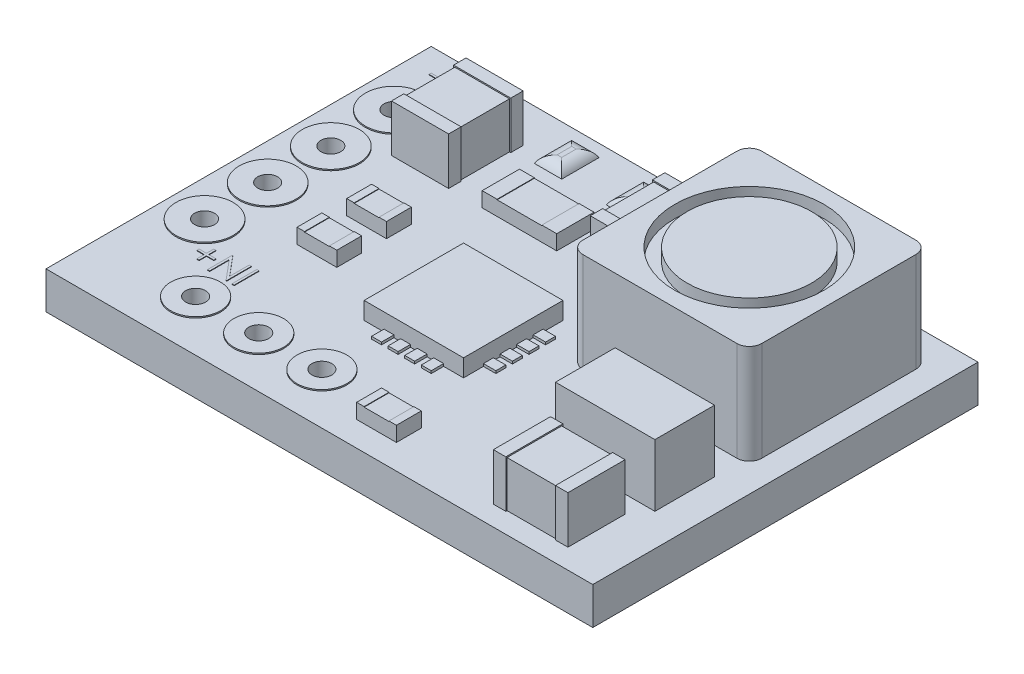
from build123d import *

# Parameters (mm, degrees)
SKICA1_W                             = 22
SKICA1_H                             = 15.5
P_IDAT_VYSUNUT_M1_DEPTH              = 1.5
SKICA2_W                             = 7.2
SKICA2_H                             = 7.2
P_IDAT_VYSUNUT_M2_DEPTH              = 4
ZAOBLIT1_R                           = 0.5
SKICA3_R                             = 3
SKICA3_R_2                           = 2.5
ODEBRAT_VYSUNUT_M1_DEPTH             = 0.5
SKICA4_W                             = 4
SKICA4_H                             = 2.4
P_IDAT_VYSUNUT_M3_DEPTH              = 2.5
SKICA5_W                             = 0.5
SKICA5_H                             = 2.3
SKICA5_W_2                           = 2.3
SKICA5_H_2                           = 0.5
P_IDAT_VYSUNUT_M4_DEPTH              = 1.9
SKICA6_W                             = 2
SKICA6_H                             = 2.2
SKICA6_W_2                           = 2.2
SKICA6_H_2                           = 2
P_IDAT_VYSUNUT_M5_DEPTH              = 1.85
SKICA7_W                             = 4
SKICA7_H                             = 4
P_IDAT_VYSUNUT_M6_DEPTH              = 0.7
SKICA8_W                             = 0.4
SKICA8_H                             = 0.5
P_IDAT_VYSUNUT_M7_DEPTH              = 0.1
SKICA9_R                             = 0.05
ODEBRAT_VYSUNUT_M2_DEPTH             = 0.2
KRUHOV_POLE1_COUNT                   = 4
SKICA11_W                            = 1.1
SKICA11_H                            = 1.5
P_IDAT_VYSUNUT_M8_DEPTH              = 0.3
ZAOBLIT2_R                           = 0.5
SKICA12_W                            = 0.6
SKICA12_H                            = 1.5
P_IDAT_VYSUNUT_M9_DEPTH              = 0.6
SKICA13_W                            = 1.8
SKICA13_H                            = 1.5
P_IDAT_VYSUNUT_M10_DEPTH             = 0.58
SKICA14_R                            = 0.4
ODEBRAT_VYSUNUT_M3_DEPTH             = 28.207535721
P_IDAT_VYSUNUT_M11_DEPTH             = 0.05
P_IDAT_VYSUNUT_M11_DEPTH_BACK        = 1.55
SKICA15_R                            = 1
SKICA15_R_2                          = 0.4
SKICA17_R                            = 0.4
ODEBRAT_VYSUNUT_M4_DEPTH             = 28.207535721
P_IDAT_VYSUNUT_M13_REACH             = 29.208
SKICA18_R                            = 1.15
SKICA18_R_2                          = 0.4
P_IDAT_VYSUNUT_M13_DIRECTION_2_REACH = 29.208
LINPOLE1_COUNT                       = 4
LINPOLE1_PITCH                       = 2.54
SKICA20_W                            = 0.3
SKICA20_H                            = 1
P_IDAT_VYSUNUT_M14_DEPTH             = 0.6
SKICA22_W                            = 1
SKICA22_H                            = 1
P_IDAT_VYSUNUT_M15_DEPTH             = 0.58
LINPOLE2_COUNT                       = 2
LINPOLE2_PITCH                       = 2
SKICA24_W                            = 0.3
SKICA24_H                            = 1
P_IDAT_VYSUNUT_M16_DEPTH             = 0.6
SKICA26_W                            = 1
SKICA26_H                            = 1
P_IDAT_VYSUNUT_M17_DEPTH             = 0.58
SKICA27_W                            = 0.08974359
SKICA27_H                            = 1
P_IDAT_VYSUNUT_M18_DEPTH             = 0.02
SKICA28_W                            = 17
SKICA28_H                            = 10
P_IDAT_VYSUNUT_M19_DEPTH             = 0.05


with BuildPart() as part:
    # Skica1 → Přidat vysunutím1 (new body)
    with BuildSketch(Plane(origin=(0, 0, 0), x_dir=(1, 0, 0), z_dir=(0, 1, 0))):
        with Locations((11, 7.75)):
            Rectangle(SKICA1_W, SKICA1_H)
    extrude(amount=P_IDAT_VYSUNUT_M1_DEPTH)

    # Skica2 → Přidat vysunutím2 (add)
    with BuildSketch(Plane(origin=(0, 1.5, 0), x_dir=(1, 0, 0), z_dir=(0, 1, 0))):
        with Locations((17.4, 10.9)):
            Rectangle(SKICA2_W, SKICA2_H)
    extrude(amount=P_IDAT_VYSUNUT_M2_DEPTH)

    # Zaoblit1
    zaoblit1_edges = [part.edges().sort_by_distance(p)[0] for p in [
        (21, 3.5, -7.3),
        (21, 3.5, -14.5),
        (13.8, 3.5, -14.5),
        (13.8, 3.5, -7.3),
    ]]
    fillet(zaoblit1_edges, radius=ZAOBLIT1_R)

    # Skica3 → Odebrat vysunutím1 (cut)
    with BuildSketch(Plane(origin=(0, 5.5, 0), x_dir=(1, 0, 0), z_dir=(0, 1, 0))):
        with Locations(Location((17.4, 10.9, 0), (0, 0, 270))):
            Circle(SKICA3_R)
        with Locations(Location((17.4, 10.9, 0), (0, 0, 270))):
            Circle(SKICA3_R_2, mode=Mode.SUBTRACT)
    extrude(amount=-ODEBRAT_VYSUNUT_M1_DEPTH, mode=Mode.SUBTRACT)

    # Skica4 → Přidat vysunutím3 (add)
    with BuildSketch(Plane(origin=(0, 1.5, 0), x_dir=(1, 0, 0), z_dir=(0, 1, 0))):
        with Locations((18.7, 5)):
            Rectangle(SKICA4_W, SKICA4_H)
    extrude(amount=P_IDAT_VYSUNUT_M3_DEPTH)

    # Skica5 → Přidat vysunutím4 (add)
    with BuildSketch(Plane(origin=(0, 1.5, 0), x_dir=(1, 0, 0), z_dir=(0, 1, 0))):
        with Locations((19.95, 1.95)):
            Rectangle(SKICA5_W, SKICA5_H)
        with Locations((17.45, 1.95)):
            Rectangle(SKICA5_W, SKICA5_H)
        with Locations((4.15, 13.65)):
            Rectangle(SKICA5_W_2, SKICA5_H_2)
        with Locations((4.15, 11.15)):
            Rectangle(SKICA5_W_2, SKICA5_H_2)
        with Locations((12.15, 13.65)):
            Rectangle(SKICA5_W_2, SKICA5_H_2)
        with Locations((12.15, 11.15)):
            Rectangle(SKICA5_W_2, SKICA5_H_2)
    extrude(amount=P_IDAT_VYSUNUT_M4_DEPTH)

    # Skica6 → Přidat vysunutím5 (add)
    with BuildSketch(Plane(origin=(0, 1.5, 0), x_dir=(1, 0, 0), z_dir=(0, 1, 0))):
        with Locations((18.7, 1.95)):
            Rectangle(SKICA6_W, SKICA6_H)
        with Locations((4.15, 12.4)):
            Rectangle(SKICA6_W_2, SKICA6_H_2)
        with Locations((12.15, 12.4)):
            Rectangle(SKICA6_W_2, SKICA6_H_2)
    extrude(amount=P_IDAT_VYSUNUT_M5_DEPTH)

    # Skica7 → Přidat vysunutím6 (add)
    with BuildSketch(Plane(origin=(0, 1.5, 0), x_dir=(1, 0, 0), z_dir=(0, 1, 0))):
        with Locations((10.2, 6.6)):
            Rectangle(SKICA7_W, SKICA7_H)
    extrude(amount=P_IDAT_VYSUNUT_M6_DEPTH)

    # Skica8 → Přidat vysunutím7 (add)
    with BuildSketch(Plane(origin=(0, 1.5, 0), x_dir=(1, 0, 0), z_dir=(0, 1, 0))):
        with Locations((9.866666667, 8.85)):
            Rectangle(SKICA8_W, SKICA8_H)
        with Locations((9.2, 8.85)):
            Rectangle(SKICA8_W, SKICA8_H)
        with Locations((10.533333333, 8.85)):
            Rectangle(SKICA8_W, SKICA8_H)
        with Locations((11.2, 8.85)):
            Rectangle(SKICA8_W, SKICA8_H)
    p_idat_vysunut_m7 = extrude(amount=P_IDAT_VYSUNUT_M7_DEPTH)

    # Skica9 → Odebrat vysunutím2 (cut)
    with BuildSketch(Plane(origin=(0, 1.5, 0), x_dir=(1, 0, 0), z_dir=(0, 1, 0))):
        with Locations(Location((10.2, 6.6, 0), (0, 0, 270))):
            Circle(SKICA9_R)
    extrude(amount=ODEBRAT_VYSUNUT_M2_DEPTH, mode=Mode.SUBTRACT)

    # Kruhové pole1: Přidat vysunutím7 ×4 about axis
    kruhov_pole1_axis = Axis((10.2, 0, -6.6), (0, 1, 0))
    for i in range(1, KRUHOV_POLE1_COUNT):
        add(p_idat_vysunut_m7.rotate(kruhov_pole1_axis, i * 360 / KRUHOV_POLE1_COUNT))

    # Skica11 → Přidat vysunutím8 (add)
    with BuildSketch(Plane(origin=(0, 1.5, 0), x_dir=(1, 0, 0), z_dir=(0, 1, 0))):
        with Locations((6.7, 14.25)):
            Rectangle(SKICA11_W, SKICA11_H)
        with Locations((9.6, 14.25)):
            Rectangle(SKICA11_W, SKICA11_H)
    extrude(amount=P_IDAT_VYSUNUT_M8_DEPTH)

    # Zaoblit2
    # the kernel refuses this fillet: 0.5 mm, written as the material it takes off along each edge
    with BuildSketch(Plane(origin=(7.904356076, 1.8, -15), x_dir=(0, -1, 0), z_dir=(1, 0, 0)), Plane(origin=(5.004356076, 1.8, -15), x_dir=(0, -1, 0), z_dir=(1, 0, 0))) as zaoblit2_piece_1:
        with BuildLine():
            CenterArc((0.5, -0.458257569), ZAOBLIT2_R, 113.578178478, 66.421821522)
            Line((0, -0.458257569), (0, 0))
            Line((0, 0), (0.3, 0))
        make_face()
    extrude(amount=3.391287847, mode=Mode.SUBTRACT)
    with BuildSketch(Plane(origin=(10.15, 1.8, -16.145643924), x_dir=(0, -1, 0), z_dir=(0, 0, 1)), Plane(origin=(9.05, 1.8, -12.354356076), x_dir=(0, -1, 0), z_dir=(0, 0, -1)), Plane(origin=(7.25, 1.8, -16.145643924), x_dir=(0, -1, 0), z_dir=(0, 0, 1)), Plane(origin=(6.15, 1.8, -12.354356076), x_dir=(0, -1, 0), z_dir=(0, 0, -1))) as zaoblit2_piece_2:
        with BuildLine():
            CenterArc((0.5, -0.458257569), ZAOBLIT2_R, 113.578178478, 66.421821522)
            Line((0, -0.458257569), (0, 0))
            Line((0, 0), (0.3, 0))
        make_face()
    extrude(amount=3.791287847, mode=Mode.SUBTRACT)
    with BuildSketch(Plane(origin=(11.295643924, 1.8, -13.5), x_dir=(0, -1, 0), z_dir=(-1, 0, 0))) as zaoblit2_piece_3_section:
        with BuildLine():
            CenterArc((0.5, -0.458257569), ZAOBLIT2_R, 113.578178478, 66.421821522)
            Line((0, -0.458257569), (0, 0))
            Line((0, 0), (0.3, 0))
        make_face()
    zaoblit2_piece_3 = extrude(amount=3.391287847, mode=Mode.PRIVATE)
    zaoblit2_piece_3 = split(zaoblit2_piece_3, bisect_by=Plane(origin=(11, 1.702438627, -13.659854903), z_dir=(-1, 0, 0)), keep=Keep.TOP, mode=Mode.PRIVATE)
    add(zaoblit2_piece_3, mode=Mode.SUBTRACT)
    with BuildSketch(Plane(origin=(8.395643924, 1.8, -13.5), x_dir=(0, -1, 0), z_dir=(-1, 0, 0))) as zaoblit2_piece_4:
        with BuildLine():
            CenterArc((0.5, -0.458257569), ZAOBLIT2_R, 113.578178478, 66.421821522)
            Line((0, -0.458257569), (0, 0))
            Line((0, 0), (0.3, 0))
        make_face()
    extrude(amount=2.245643924, mode=Mode.SUBTRACT)

    # Skica12 → Přidat vysunutím9 (add)
    with BuildSketch(Plane(origin=(0, 1.5, 0), x_dir=(1, 0, 0), z_dir=(0, 1, 0))):
        with Locations((6.95, 11.65)):
            Rectangle(SKICA12_W, SKICA12_H)
        with Locations((9.35, 11.65)):
            Rectangle(SKICA12_W, SKICA12_H)
    extrude(amount=P_IDAT_VYSUNUT_M9_DEPTH)

    # Skica13 → Přidat vysunutím10 (add)
    with BuildSketch(Plane(origin=(0, 1.5, 0), x_dir=(1, 0, 0), z_dir=(0, 1, 0))):
        with Locations((8.15, 11.65)):
            Rectangle(SKICA13_W, SKICA13_H)
    extrude(amount=P_IDAT_VYSUNUT_M10_DEPTH)

    # Skica14 → Odebrat vysunutím3 (cut, through all)
    with BuildSketch(Plane(origin=(0, 1.5, 0), x_dir=(1, 0, 0), z_dir=(0, 1, 0))):
        with Locations(Location((4.02, 2, 0), (0, 0, 270))):
            Circle(SKICA14_R)
        with Locations(Location((6.56, 2, 0), (0, 0, 270))):
            Circle(SKICA14_R)
        with Locations(Location((9.1, 2, 0), (0, 0, 270))):
            Circle(SKICA14_R)
    extrude(amount=-ODEBRAT_VYSUNUT_M3_DEPTH, mode=Mode.SUBTRACT)

    # Skica15 → Přidat vysunutím11 (add, two sides: drawn at the far end of the back side and taken through both)
    # profile 1 of 3: a face of its own
    with BuildSketch(Plane(origin=(0, 1.5, 0), x_dir=(1, 0, 0), z_dir=(0, 1, 0)).offset(-P_IDAT_VYSUNUT_M11_DEPTH_BACK)):
        with Locations(Location((4.02, 2, 0), (0, 0, 90))):
            Circle(SKICA15_R)
        with Locations(Location((4.02, 2, 0), (0, 0, 270))):
            Circle(SKICA15_R_2, mode=Mode.SUBTRACT)
    # profile 2 of 3: a face of its own
    with BuildSketch(Plane(origin=(0, 1.5, 0), x_dir=(1, 0, 0), z_dir=(0, 1, 0)).offset(-P_IDAT_VYSUNUT_M11_DEPTH_BACK)):
        with Locations(Location((6.56, 2, 0), (0, 0, 90))):
            Circle(SKICA15_R)
        with Locations(Location((6.56, 2, 0), (0, 0, 270))):
            Circle(SKICA15_R_2, mode=Mode.SUBTRACT)
    # profile 3 of 3: a face of its own
    with BuildSketch(Plane(origin=(0, 1.5, 0), x_dir=(1, 0, 0), z_dir=(0, 1, 0)).offset(-P_IDAT_VYSUNUT_M11_DEPTH_BACK)):
        with Locations(Location((9.1, 2, 0), (0, 0, 90))):
            Circle(SKICA15_R)
        with Locations(Location((9.1, 2, 0), (0, 0, 270))):
            Circle(SKICA15_R_2, mode=Mode.SUBTRACT)
    extrude(amount=P_IDAT_VYSUNUT_M11_DEPTH + P_IDAT_VYSUNUT_M11_DEPTH_BACK)

    # Skica17 → Odebrat vysunutím4 (cut, through all)
    with BuildSketch(Plane(origin=(0, 1.5, 0), x_dir=(1, 0, 0), z_dir=(0, 1, 0))):
        with Locations(Location((1.5, 12.5, 0), (0, 0, 270))):
            Circle(SKICA17_R)
    odebrat_vysunut_m4 = extrude(amount=-ODEBRAT_VYSUNUT_M4_DEPTH, mode=Mode.SUBTRACT)

    # Přidat vysunutím13: up to this face of the body (flat: up to its plane)
    p_idat_vysunut_m13_end = Plane(part.part.faces().sort_by_distance((4.02, 1.55, -1.028284271))[0])
    # Skica18 → Přidat vysunutím13 (add, up to the picked face)
    with BuildSketch(Plane(origin=(0, 1.5, 0), x_dir=(1, 0, 0), z_dir=(0, 1, 0)), mode=Mode.PRIVATE) as p_idat_vysunut_m13_sk1:
        with Locations(Location((1.5, 12.5, 0), (0, 0, 90))):
            Circle(SKICA18_R)
        with Locations(Location((1.5, 12.5, 0), (0, 0, 270))):
            Circle(SKICA18_R_2, mode=Mode.SUBTRACT)
    p_idat_vysunut_m13_tool1 = split(extrude(p_idat_vysunut_m13_sk1.sketch, amount=P_IDAT_VYSUNUT_M13_REACH, mode=Mode.PRIVATE), bisect_by=p_idat_vysunut_m13_end, keep=Keep.BOTH, mode=Mode.PRIVATE)
    p_idat_vysunut_m13 = p_idat_vysunut_m13_tool1.solids().sort_by(Axis((1.5, 1.5, -11.382527), (0, 1, 0)))[0]
    add(p_idat_vysunut_m13)

    # Přidat vysunutím13 direction 2: up to this face of the body (flat: up to its plane)
    p_idat_vysunut_m13_direction_2_end = Plane(part.part.faces().sort_by_distance((4.02, -0.05, -1.028284271))[0])
    # Skica18 → Přidat vysunutím13 direction 2 (add, up to the picked face)
    with BuildSketch(Plane(origin=(0, 1.5, 0), x_dir=(1, 0, 0), z_dir=(0, 1, 0)), mode=Mode.PRIVATE) as p_idat_vysunut_m13_direction_2_sk1:
        with Locations(Location((1.5, 12.5, 0), (0, 0, 90))):
            Circle(SKICA18_R)
        with Locations(Location((1.5, 12.5, 0), (0, 0, 270))):
            Circle(SKICA18_R_2, mode=Mode.SUBTRACT)
    p_idat_vysunut_m13_direction_2_tool1 = split(extrude(p_idat_vysunut_m13_direction_2_sk1.sketch, amount=-P_IDAT_VYSUNUT_M13_DIRECTION_2_REACH, mode=Mode.PRIVATE), bisect_by=p_idat_vysunut_m13_direction_2_end, keep=Keep.BOTH, mode=Mode.PRIVATE)
    p_idat_vysunut_m13_direction_2 = p_idat_vysunut_m13_direction_2_tool1.solids().sort_by(Axis((1.5, 1.5, -11.382527), (0, -1, 0)))[0]
    add(p_idat_vysunut_m13_direction_2)

    # LinPole1: Odebrat vysunutím4, Přidat vysunutím13, Přidat vysunutím13 direction 2 ×4
    with Locations(*[(0, 0, i * LINPOLE1_PITCH) for i in range(1, LINPOLE1_COUNT)]):
        add(odebrat_vysunut_m4, mode=Mode.SUBTRACT)
        add(p_idat_vysunut_m13)
        add(p_idat_vysunut_m13_direction_2)

    # Skica20 → Přidat vysunutím14 (add)
    with BuildSketch(Plane(origin=(-4.506152871, 1.5, 3.654708199), x_dir=(1, 0, 0), z_dir=(0, 1, 0))):
        with Locations((8.856152871, 12.054708199)):
            Rectangle(SKICA20_W, SKICA20_H)
        with Locations((10.156152871, 12.054708199)):
            Rectangle(SKICA20_W, SKICA20_H)
    p_idat_vysunut_m14 = extrude(amount=P_IDAT_VYSUNUT_M14_DEPTH)

    # Skica22 → Přidat vysunutím15 (add)
    with BuildSketch(Plane(origin=(-4.506152871, 1.5, 3.654708199), x_dir=(1, 0, 0), z_dir=(0, 1, 0))):
        with Locations((9.506152871, 12.054708199)):
            Rectangle(SKICA22_W, SKICA22_H)
    p_idat_vysunut_m15 = extrude(amount=P_IDAT_VYSUNUT_M15_DEPTH)

    # LinPole2: Přidat vysunutím14, Přidat vysunutím15 ×2
    with Locations(*[(0, 0, i * LINPOLE2_PITCH) for i in range(1, LINPOLE2_COUNT)]):
        add(p_idat_vysunut_m14)
        add(p_idat_vysunut_m15)

    # Skica24 → Přidat vysunutím16 (add)
    with BuildSketch(Plane(origin=(2.475375397, 1.5, 8.823230258), x_dir=(1, 0, 0), z_dir=(0, 1, 0))):
        with Locations((9.174624603, 10.323230258)):
            Rectangle(SKICA24_W, SKICA24_H)
        with Locations((10.474624603, 10.323230258)):
            Rectangle(SKICA24_W, SKICA24_H)
    extrude(amount=P_IDAT_VYSUNUT_M16_DEPTH)

    # Skica26 → Přidat vysunutím17 (add)
    with BuildSketch(Plane(origin=(2.475375397, 1.5, 8.823230258), x_dir=(1, 0, 0), z_dir=(0, 1, 0))):
        with Locations((9.824624603, 10.323230258)):
            Rectangle(SKICA26_W, SKICA26_H)
    extrude(amount=P_IDAT_VYSUNUT_M17_DEPTH)

    # Skica27 → Přidat vysunutím18 (add)
    # profile 1 of 5: a face of its own
    with BuildSketch(Plane(origin=(0, 1.5, 0), x_dir=(1, 0, 0), z_dir=(0, 1, 0))):
        with BuildLine():
            Line((2.371794872, 14), (2.176682692, 14))
            add(Edge.make_bspline(
                [(2.176682692, 14), (2.167131548, 14.000049424), (2.148619053, 14.00014522), (2.12170126, 14.001665429), (2.096480222, 14.003686404), (2.07300051, 14.00707648), (2.051109344, 14.010591542), (2.031028966, 14.015750811), (2.012591176, 14.021449412), (1.990451165, 14.030217484), (1.965330289, 14.043834408), (1.938330047, 14.064029602), (1.91485979, 14.088242008), (1.894903114, 14.115833955), (1.878887457, 14.146188223), (1.867447419, 14.178651731), (1.860097902, 14.212678319), (1.859351552, 14.236006691), (1.858974359, 14.247796474)],
                knots=[0, 0, 0, 0, 1.00128172, 1.940733171, 2.826250472, 3.653024905, 4.427672124, 5.149348099, 5.824709082, 6.450061444, 7.643590664, 8.808605388, 9.972104426, 11.165284501, 12.367876273, 13.557044126, 14.765369432, 16, 16, 16, 16], degree=3))
            add(Edge.make_bspline(
                [(1.858974359, 14.247796474), (1.859282456, 14.258841472), (1.859887895, 14.280545934), (1.865802547, 14.312184799), (1.874730571, 14.342397079), (1.887614251, 14.37089162), (1.904042026, 14.39741804), (1.924028884, 14.421523866), (1.947727818, 14.442735822), (1.965521109, 14.454540578), (1.974559295, 14.460536859)],
                knots=[0, 0, 0, 0, 1.044356178, 2.052258378, 3.035953355, 4.020338374, 5.002448483, 5.980768927, 6.974322109, 8, 8, 8, 8], degree=3))
            add(Edge.make_bspline(
                [(1.974559295, 14.460536859), (1.963198366, 14.464896332), (1.941462096, 14.473237083), (1.911511473, 14.488040548), (1.885698273, 14.504018166), (1.863689835, 14.52128705), (1.845248319, 14.540411077), (1.828819876, 14.560886602), (1.814877561, 14.583426719), (1.802981656, 14.607542995), (1.793558209, 14.633107718), (1.787017026, 14.659929634), (1.782868587, 14.687704948), (1.782326103, 14.706582499), (1.782051282, 14.716145833)],
                knots=[0, 0, 0, 0, 1.272200328, 2.434034374, 3.488177493, 4.442517805, 5.351202203, 6.260825393, 7.183200622, 8.11705787, 9.069326169, 10.026320267, 11.000137371, 12, 12, 12, 12], degree=3))
            add(Edge.make_bspline(
                [(1.782051282, 14.716145833), (1.782330408, 14.725907781), (1.782879595, 14.745114685), (1.786930633, 14.77333067), (1.793791784, 14.800294088), (1.803235509, 14.826184419), (1.81554588, 14.850850032), (1.830418088, 14.87448477), (1.848267874, 14.896738363), (1.868368489, 14.917933739), (1.890794991, 14.937315994), (1.915507243, 14.953972467), (1.941871894, 14.968359347), (1.970249976, 14.979925592), (2.000440129, 14.988979846), (2.032449424, 14.995239942), (2.066259685, 14.999474937), (2.089462808, 14.999822009), (2.101362179, 15)],
                knots=[0, 0, 0, 0, 0.978522333, 1.925270105, 2.85076145, 3.763600118, 4.682725947, 5.609499657, 6.557784645, 7.537954401, 8.534920712, 9.522742111, 10.520247711, 11.5409147, 12.58930695, 13.675078472, 14.807699069, 16, 16, 16, 16], degree=3))
            Line((2.101362179, 15), (2.371794872, 15))
            Line((2.371794872, 15), (2.371794872, 14))
        make_face()
        with BuildLine():
            Line((2.282051282, 14.102564103), (2.282051282, 14.423076923))
            Line((2.282051282, 14.423076923), (2.221754808, 14.423076923))
            add(Edge.make_bspline(
                [(2.221754808, 14.423076923), (2.212940787, 14.42296361), (2.195910302, 14.422744667), (2.171181934, 14.42209773), (2.148285556, 14.420365606), (2.127142277, 14.418533595), (2.107893793, 14.415712686), (2.090475718, 14.412260649), (2.07473141, 14.408641835), (2.056583557, 14.402469698), (2.036000781, 14.393443411), (2.014212585, 14.379092326), (1.994602229, 14.362476873), (1.978424818, 14.342768348), (1.964956535, 14.321484924), (1.955888864, 14.298467889), (1.949566546, 14.274510417), (1.949003712, 14.257988105), (1.948717949, 14.249599359)],
                knots=[0, 0, 0, 0, 1.156584208, 2.234756387, 3.244705828, 4.168772894, 5.018724976, 5.795346628, 6.498686023, 7.135894168, 8.308330183, 9.43588092, 10.547699294, 11.667188675, 12.76860303, 13.837480448, 14.902040606, 16, 16, 16, 16], degree=3))
            add(Edge.make_bspline(
                [(1.948717949, 14.249599359), (1.94885732, 14.244045826), (1.949130712, 14.233151964), (1.951708089, 14.217280233), (1.955264838, 14.202176618), (1.961130802, 14.188248285), (1.968080455, 14.175006154), (1.976988249, 14.162868518), (1.987259755, 14.151506566), (1.999235044, 14.141224847), (2.012865162, 14.131925625), (2.028581881, 14.124184467), (2.045957901, 14.117304994), (2.065355566, 14.112090193), (2.086388492, 14.107562915), (2.109377567, 14.104708039), (2.134184243, 14.102874021), (2.151371843, 14.102669713), (2.16025641, 14.102564103)],
                knots=[0, 0, 0, 0, 0.911412742, 1.787835618, 2.63643285, 3.453173233, 4.262886967, 5.08783453, 5.918594724, 6.773969545, 7.67442701, 8.62112486, 9.645634318, 10.739428598, 11.916091468, 13.177237585, 14.540865421, 16, 16, 16, 16], degree=3))
            Line((2.16025641, 14.102564103), (2.282051282, 14.102564103))
        make_face(mode=Mode.SUBTRACT)
        with BuildLine():
            Line((2.282051282, 14.525641026), (2.282051282, 14.897435897))
            Line((2.282051282, 14.897435897), (2.154246795, 14.897435897))
            add(Edge.make_bspline(
                [(2.154246795, 14.897435897), (2.145099445, 14.897315712), (2.127469134, 14.897084072), (2.101994628, 14.89653442), (2.078509083, 14.894495215), (2.056816957, 14.89254015), (2.037018619, 14.889346146), (2.018921495, 14.886253249), (2.002938931, 14.881701897), (1.984238409, 14.875439156), (1.963322062, 14.865430466), (1.940480425, 14.85071183), (1.920361694, 14.832783448), (1.903292361, 14.812139932), (1.889099959, 14.789925783), (1.879281619, 14.766097277), (1.872919894, 14.741450325), (1.872170634, 14.724597644), (1.871794872, 14.716145833)],
                knots=[0, 0, 0, 0, 1.16016216, 2.236059617, 3.229676189, 4.14889023, 4.996733752, 5.772278665, 6.474820656, 7.101410824, 8.271817372, 9.403828207, 10.537358096, 11.673541442, 12.791884111, 13.865947414, 14.929748409, 16, 16, 16, 16], degree=3))
            add(Edge.make_bspline(
                [(1.871794872, 14.716145833), (1.871871576, 14.710861229), (1.872023748, 14.700377262), (1.87441574, 14.684984297), (1.877735213, 14.669999682), (1.882627184, 14.655626958), (1.888545138, 14.641618631), (1.896352428, 14.628430504), (1.905158993, 14.615501181), (1.91879903, 14.598963145), (1.938909125, 14.580138545), (1.967496334, 14.56193839), (1.999819245, 14.547022796), (2.023317922, 14.540717229), (2.035456731, 14.537459936)],
                knots=[0, 0, 0, 0, 0.723354195, 1.435040621, 2.129761981, 2.824182007, 3.512608497, 4.209435533, 4.920062464, 5.654614313, 7.143585817, 8.671381114, 10.280521501, 12, 12, 12, 12], degree=3))
            add(Edge.make_bspline(
                [(2.035456731, 14.537459936), (2.040322182, 14.536472703), (2.050871484, 14.534332177), (2.068073738, 14.53207411), (2.08777841, 14.530048549), (2.10990128, 14.52858958), (2.134530334, 14.527023402), (2.161657659, 14.52643599), (2.191302432, 14.525719022), (2.211871707, 14.525667689), (2.22255609, 14.525641026)],
                knots=[0, 0, 0, 0, 0.634452549, 1.375623993, 2.216454381, 3.166361212, 4.209414599, 5.370755378, 6.634280627, 8, 8, 8, 8], degree=3))
            Line((2.22255609, 14.525641026), (2.282051282, 14.525641026))
        make_face(mode=Mode.SUBTRACT)
    # profile 2 of 5: a face of its own
    with BuildSketch(Plane(origin=(0, 1.5, 0), x_dir=(1, 0, 0), z_dir=(0, 1, 0))):
        Polygon((1.333333333, 14.461538462), (1.333333333, 14.166666667), (1.243589744, 14.166666667), (1.243589744, 14.461538462), (0.948717949, 14.461538462), (0.948717949, 14.551282051), (1.243589744, 14.551282051), (1.243589744, 14.846153846), (1.333333333, 14.846153846), (1.333333333, 14.551282051), (1.628205128, 14.551282051), (1.628205128, 14.461538462), align=None)
    # profile 3 of 5: a face of its own
    with BuildSketch(Plane(origin=(0, 1.5, 0), x_dir=(1, 0, 0), z_dir=(0, 1, 0))):
        with Locations((4.326923077, 3.7)):
            Rectangle(SKICA27_W, SKICA27_H)
    # profile 4 of 5: a face of its own
    with BuildSketch(Plane(origin=(0, 1.5, 0), x_dir=(1, 0, 0), z_dir=(0, 1, 0))):
        Polygon((4.064102564, 4.2), (4.064102564, 3.2), (4.045272436, 3.2), (3.384615385, 3.987059295), (3.384615385, 3.2), (3.294871795, 3.2), (3.294871795, 4.2), (3.315304487, 4.2), (3.974358974, 3.41474359), (3.974358974, 4.2), align=None)
    # profile 5 of 5: a face of its own
    with BuildSketch(Plane(origin=(0, 1.5, 0), x_dir=(1, 0, 0), z_dir=(0, 1, 0))):
        Polygon((2.794871795, 3.661538462), (2.794871795, 3.366666667), (2.705128205, 3.366666667), (2.705128205, 3.661538462), (2.41025641, 3.661538462), (2.41025641, 3.751282051), (2.705128205, 3.751282051), (2.705128205, 4.046153846), (2.794871795, 4.046153846), (2.794871795, 3.751282051), (3.08974359, 3.751282051), (3.08974359, 3.661538462), align=None)
    extrude(amount=P_IDAT_VYSUNUT_M18_DEPTH)

    # Skica28 → Přidat vysunutím19 (add)
    with BuildSketch(Plane.XZ):
        with Locations((13, -10)):
            Rectangle(SKICA28_W, SKICA28_H)
    extrude(amount=P_IDAT_VYSUNUT_M19_DEPTH)


solid = part.part
